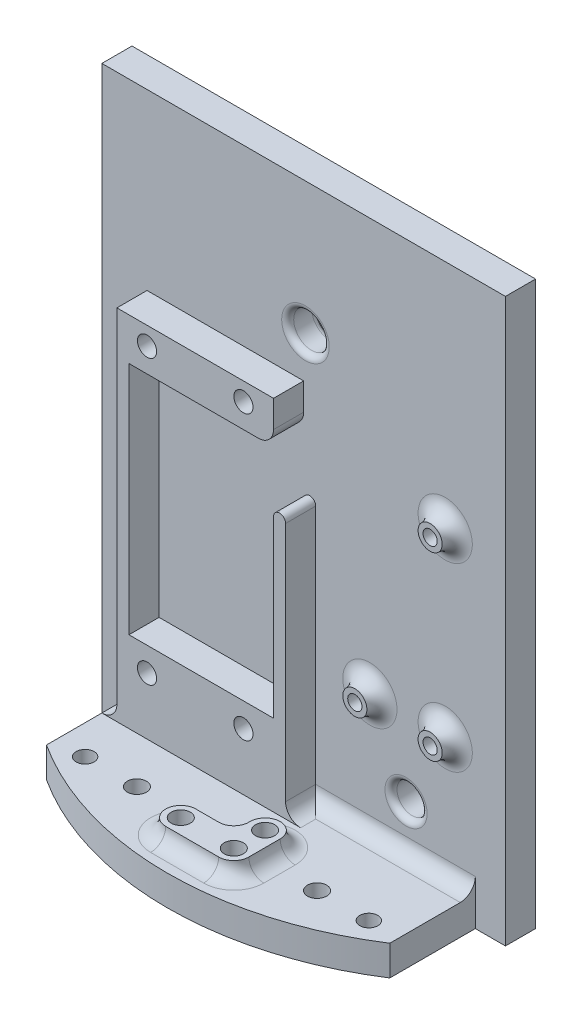
from build123d import *

# Parameters (mm, degrees)
SKETCH2_W                          = 85.09
SKETCH2_H                          = 118.618
BOSS1_MAIN_FIGURE_DEPTH            = 6.35
SKETCH3_W                          = 72.39
SKETCH3_H                          = 6.35
BOSS2_BOTTOM_PLATE_DEPTH           = 18.034
BOSS3_BOTTOM_ROUNDED_CAP_DEPTH     = 6.35
BOSS3_CARD_HOLDER_DEPTH            = 6.35
FILLET1_BOTTOM_PLATE_R             = 3.175
HOLES1_MAIN_PLATE_D                = 4.0386
HOLES3_UPPER_LARGE_D               = 7.493
HOLES4_LOWER_LARGE_D               = 6.35
FILLET2_LARGE_HOLES_R              = 1.27
HOLES5_SMALL_BOTTOM_PLATE_D        = 4.0386
SKETCH32_R                         = 2.54
BOSS4_MAIN_PLATE_STANDOFFS_DEPTH   = 3.175
HOLES5_MAIN_PLATE_D                = 3.000000096
FILLET3_MAIN_PLATE_STANDOFFS_R     = 3.175
BOSS5_BOTTOM_PLATE_STANDOFFS_DEPTH = 3.175
FILLET4_BOTTOM_PLATE_STANDOFFS_R   = 3.175
HOLES6_BOTTOM_PLATE_D              = 4.0386
HOLES7_D                           = 3.7973


with BuildPart() as part:
    # Sketch2 → Boss1 - Main Figure (new body)
    with BuildSketch(Plane.XY):
        with Locations((42.545, 59.309)):
            Rectangle(SKETCH2_W, SKETCH2_H)
    extrude(amount=BOSS1_MAIN_FIGURE_DEPTH)

    # Sketch3 → Boss2 - Bottom Plate (add)
    with BuildSketch(Plane.XY.offset(6.35)):
        with Locations((42.545, 3.175)):
            Rectangle(SKETCH3_W, SKETCH3_H)
    extrude(amount=BOSS2_BOTTOM_PLATE_DEPTH)

    # Sketch4 → Boss3 - Bottom Rounded Cap (add)
    with BuildSketch(Plane.XZ):
        with BuildLine():
            Line((6.35, 24.384), (78.74, 24.384))
            ThreePointArc((78.74, 24.384), (42.545, 35.039502522), (6.35, 24.384))
        make_face()
    extrude(amount=-BOSS3_BOTTOM_ROUNDED_CAP_DEPTH)

    # Sketch7 → Boss3 - Card Holder (add)
    with BuildSketch(Plane.XY.offset(6.35)):
        with BuildLine():
            Line((9.525, 6.35), (45.085, 6.35))
            Line((45.085, 6.35), (45.085, 23.495))
            Line((45.085, 23.495), (45.085, 60.325))
            ThreePointArc((45.085, 60.325), (43.815, 61.595), (42.545, 60.325))
            Line((42.545, 60.325), (42.545, 23.495))
            Line((42.545, 23.495), (12.065, 23.495))
            Line((12.065, 23.495), (12.065, 73.025))
            Line((12.065, 73.025), (39.37, 73.025))
            ThreePointArc((39.37, 73.025), (41.61506403, 73.95493597), (42.545, 76.2))
            Line((42.545, 76.2), (42.545, 81.915))
            Line((42.545, 81.915), (9.525, 81.915))
            Line((9.525, 81.915), (9.525, 73.025))
            Line((9.525, 73.025), (9.525, 23.495))
            Line((9.525, 23.495), (9.525, 6.35))
        make_face()
    extrude(amount=BOSS3_CARD_HOLDER_DEPTH)

    # Fillet1 - Bottom Plate
    fillet1_bottom_plate_edges = [part.edges().sort_by_distance(p)[0] for p in [
        (61.9125, 6.35, 6.35),
        (7.9375, 6.35, 6.35),
        (9.525, 6.35, 9.525),
        (45.085, 6.35, 9.525),
    ]]
    fillet(fillet1_bottom_plate_edges, radius=FILLET1_BOTTOM_PLATE_R - 0.0001)  # a hair under: the kernel refuses the full size

    # Holes1 - Main Plate (through all)
    with Locations(Plane(origin=(36.195, 78.105, 0), x_dir=(-1, 0, 0), z_dir=(0, 0, -1))):
        with Locations((0, 0), (20.32, 0), (0, -59.69), (20.32, -59.69)):
            Hole(HOLES1_MAIN_PLATE_D / 2)

    # Holes3 - Upper Large (through all)
    with Locations(Plane(origin=(0, 0, 0), x_dir=(-1, 0, 0), z_dir=(0, 0, -1))):
        with Locations((-42.926, 90.805)):
            Hole(HOLES3_UPPER_LARGE_D / 2)

    # Holes4 - Lower Large (through all)
    with Locations(Plane(origin=(0, 0, 0), x_dir=(-1, 0, 0), z_dir=(0, 0, -1))):
        with Locations((-64.135, 15.875)):
            Hole(HOLES4_LOWER_LARGE_D / 2)

    # Fillet2 - Large Holes
    fillet2_large_holes_edges = [part.edges().sort_by_distance(p)[0] for p in [
        (39.1795, 90.805, 6.35),
        (39.1795, 90.805, 0),
        (60.96, 15.875, 6.35),
        (60.96, 15.875, 0),
    ]]
    fillet(fillet2_large_holes_edges, radius=FILLET2_LARGE_HOLES_R)

    # Holes5 - Small Bottom Plate (through all)
    with Locations(Plane(origin=(0, 0, 0), x_dir=(-1, 0, 0), z_dir=(0, -1, 0))):
        with Locations((-23.495, -22.4536), (-61.468, -22.4536)):
            Hole(HOLES5_SMALL_BOTTOM_PLATE_D / 2)

    # Sketch32 → Boss4 - Main Plate Standoffs (add)
    with BuildSketch(Plane.XY.offset(6.35)):
        with Locations(Location((72.39, 69.85, 0), (0, 0, 180))):
            Circle(SKETCH32_R)
        with Locations(Location((56.515, 31.75, 0), (0, 0, 180))):
            Circle(SKETCH32_R)
        with Locations(Location((72.39, 31.75, 0), (0, 0, 180))):
            Circle(SKETCH32_R)
    extrude(amount=BOSS4_MAIN_PLATE_STANDOFFS_DEPTH)

    # Holes5 - Main Plate (through all)
    with Locations(Plane.XY.offset(9.525)):
        with Locations((72.39, 69.85), (72.39, 31.75), (56.515, 31.75)):
            Hole(HOLES5_MAIN_PLATE_D / 2)

    # Fillet3 - Main Plate Standoffs
    fillet3_main_plate_standoffs_edges = [part.edges().sort_by_distance(p)[0] for p in [
        (74.93, 69.85, 6.35),
        (59.055, 31.75, 6.35),
        (74.93, 31.75, 6.35),
    ]]
    fillet(fillet3_main_plate_standoffs_edges, radius=FILLET3_MAIN_PLATE_STANDOFFS_R - 0.0001)  # a hair under: the kernel refuses the full size

    # Sketch36 → Boss5 - Bottom Plate Standoffs (add)
    with BuildSketch(Plane(origin=(0, 6.35, 0), x_dir=(1, 0, 0), z_dir=(0, 1, 0))):
        with BuildLine():
            Line((36.957, -23.495), (41.783, -23.495))
            ThreePointArc((41.783, -23.495), (44.02806403, -22.56506403), (44.958, -20.32))
            Line((44.958, -20.32), (44.958, -20.066))
            ThreePointArc((44.958, -20.066), (48.133, -16.891), (51.308, -20.066))
            Line((51.308, -20.066), (51.308, -26.67))
            ThreePointArc((51.308, -26.67), (50.37806403, -28.91506403), (48.133, -29.845))
            Line((48.133, -29.845), (36.957, -29.845))
            ThreePointArc((36.957, -29.845), (33.782, -26.67), (36.957, -23.495))
        make_face()
    extrude(amount=BOSS5_BOTTOM_PLATE_STANDOFFS_DEPTH)

    # Fillet4 - Bottom Plate Standoffs
    fillet4_bottom_plate_standoffs_edges = [part.edges().sort_by_distance(p)[0] for p in [
        (39.37, 6.35, 23.495),
        (44.958, 6.35, 20.193),
        (44.02806403, 6.35, 22.56506403),
        (33.782, 6.35, 26.67),
        (48.133, 6.35, 16.891),
        (51.308, 6.35, 23.368),
        (50.37806403, 6.35, 28.91506403),
        (42.545, 6.35, 29.845),
    ]]
    fillet(fillet4_bottom_plate_standoffs_edges, radius=FILLET4_BOTTOM_PLATE_STANDOFFS_R - 0.0001)  # a hair under: the kernel refuses the full size

    # Holes6 - Bottom Plate (through all)
    with Locations(Plane(origin=(0, 9.525, 0), x_dir=(1, 0, 0), z_dir=(0, 1, 0))):
        with Locations((36.957, -26.67), (48.133, -26.67), (48.133, -20.066)):
            Hole(HOLES6_BOTTOM_PLATE_D / 2)

    # Holes7 (through all)
    with Locations(Plane(origin=(0, 6.35, 0), x_dir=(1, 0, 0), z_dir=(0, 1, 0))):
        with Locations((72.39, -22.4536), (12.573, -22.4536)):
            Hole(HOLES7_D / 2)


solid = part.part
